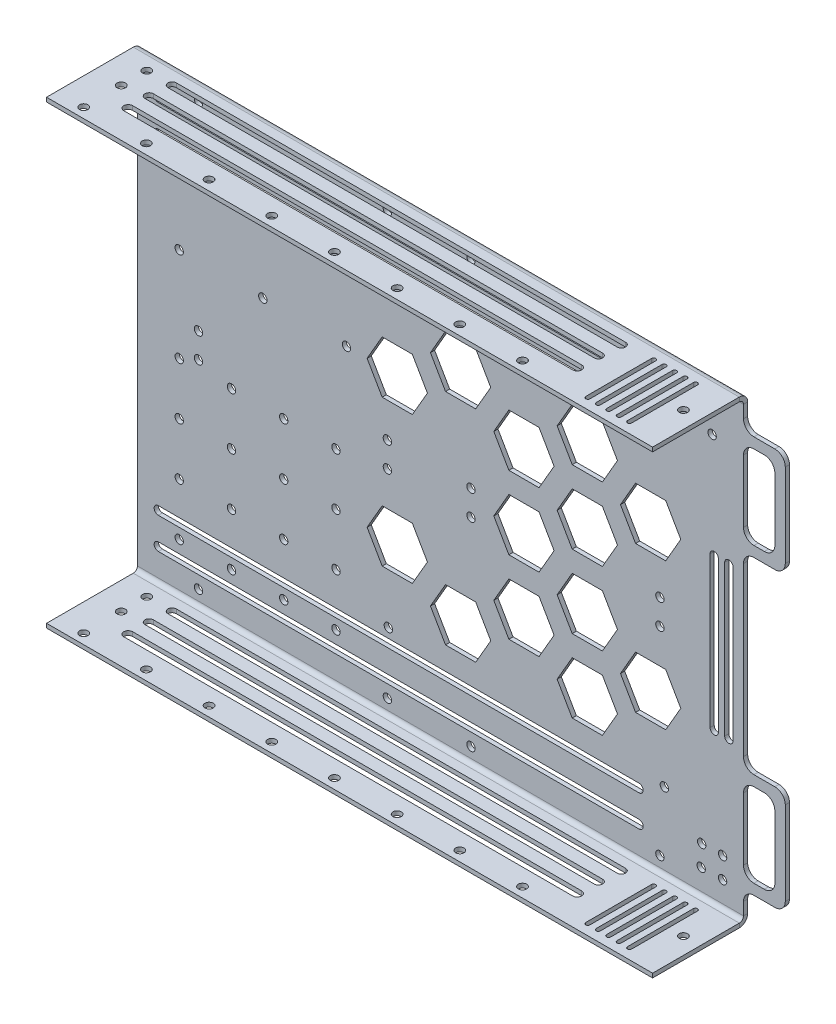
from build123d import *

# Parameters (mm, degrees)
BASE_FLANGE1_DEPTH           = 2
EDGE_FLANGE2_STRIP_W         = 12
EDGE_FLANGE2_STRIP_H         = 2
EDGE_FLANGE2_STRIP_CUT_DEPTH = 290
EDGE_FLANGE2_DEPTH           = 290
SKETCH24_R                   = 2
CUT_EXTRUDE2_DEPTH           = 268.567281258
MINI_ITX_R                   = 2
CUT_EXTRUDE3_DEPTH           = 329.469557189
VARIOS_R                     = 2
CUT_EXTRUDE6_DEPTH           = 329.469557189
CUT_EXTRUDE7_DEPTH           = 329.469557189
SKETCH33_R                   = 2
CUT_EXTRUDE9_DEPTH           = 329.469557189
CUT_EXTRUDE15_DEPTH          = 10


# Sheet-metal steps are written as plain solids
with BuildPart() as part:
    # Sketch1 → Base-Flange1 (new body)
    with BuildSketch(Plane.XY):
        with BuildLine():
            Line((220, 0), (220, 10))
            ThreePointArc((220, 10), (221.464466094, 13.535533906), (225, 15))
            Line((225, 15), (235, 15))
            ThreePointArc((235, 15), (238.535533906, 16.464466094), (240, 20))
            Line((240, 20), (240, 60))
            ThreePointArc((240, 60), (238.535533906, 63.535533906), (235, 65))
            Line((235, 65), (225, 65))
            ThreePointArc((225, 65), (221.464466094, 66.464466094), (220, 70))
            Line((220, 70), (220, 110))
            Line((220, 110), (-70, 110))
            Line((-70, 110), (-70, 0))
            Line((-70, 0), (220, 0))
        make_face()
        with BuildLine():
            Line((230, 20), (225, 20))
            ThreePointArc((225, 20), (221.464466094, 21.464466094), (220, 25))
            Line((220, 25), (220, 55))
            ThreePointArc((220, 55), (221.464466094, 58.535533906), (225, 60))
            Line((225, 60), (230, 60))
            ThreePointArc((230, 60), (233.535533906, 58.535533906), (235, 55))
            Line((235, 55), (235, 25))
            ThreePointArc((235, 25), (233.535533906, 21.464466094), (230, 20))
        make_face(mode=Mode.SUBTRACT)
    extrude(amount=-BASE_FLANGE1_DEPTH)

    # Edge-Flange2 strip (across the edge) → Edge-Flange2 strip cut (cut)
    with BuildSketch(Plane.YZ.offset(-70)):
        with Locations((-2, -1)):
            Rectangle(EDGE_FLANGE2_STRIP_W, EDGE_FLANGE2_STRIP_H)
    extrude(amount=EDGE_FLANGE2_STRIP_CUT_DEPTH, mode=Mode.SUBTRACT)

    # Edge-Flange2 section (across the edge) → Edge-Flange2 (add)
    with BuildSketch(Plane.YZ.offset(-70)):
        with BuildLine():
            Line((0, 2), (0, 43.5))
            Line((0, 43.5), (2, 43.5))
            Line((2, 43.5), (2, 2))
            ThreePointArc((2, 2), (2.585786438, 0.585786438), (4, 0))
            Line((4, 0), (4, -2))
            ThreePointArc((4, -2), (1.171572875, -0.828427125), (0, 2))
        make_face()
    extrude(amount=EDGE_FLANGE2_DEPTH)

    # Sketch24 → Cut-Extrude2 (cut, through all)
    with BuildSketch(Plane.XZ):
        with Locations(Location((-57, 8.5, 0), (0, 0, 270))):
            Circle(SKETCH24_R)
        with Locations(Location((212, 20.75, 0), (0, 0, 270))):
            Circle(SKETCH24_R)
        with Locations(Location((-57, 20.75, 0), (0, 0, 270))):
            Circle(SKETCH24_R)
        with Locations(Location((3, 38.737273217, 0), (0, 0, 270))):
            Circle(SKETCH24_R)
        with Locations(Location((33, 38.737273217, 0), (0, 0, 270))):
            Circle(SKETCH24_R)
        with Locations(Location((63, 38.737273217, 0), (0, 0, 270))):
            Circle(SKETCH24_R)
        with Locations(Location((93, 38.737273217, 0), (0, 0, 270))):
            Circle(SKETCH24_R)
        with Locations(Location((123, 38.737273217, 0), (0, 0, 270))):
            Circle(SKETCH24_R)
        with Locations(Location((153, 38.737273217, 0), (0, 0, 270))):
            Circle(SKETCH24_R)
        with Locations(Location((-27, 38.737273217, 0), (0, 0, 270))):
            Circle(SKETCH24_R)
        with Locations(Location((-57, 38.737273217, 0), (0, 0, 270))):
            Circle(SKETCH24_R)
        with BuildLine():
            Line((205, 38.5), (205, 7))
            ThreePointArc((205, 7), (204, 6), (203, 7))
            Line((203, 7), (203, 38.5))
            ThreePointArc((203, 38.5), (204, 39.5), (205, 38.5))
        make_face()
        with BuildLine():
            Line((198, 7), (198, 38.5))
            ThreePointArc((198, 38.5), (199, 39.5), (200, 38.5))
            Line((200, 38.5), (200, 7))
            ThreePointArc((200, 7), (199, 6), (198, 7))
        make_face()
        with BuildLine():
            Line((193, 7), (193, 38.5))
            ThreePointArc((193, 38.5), (194, 39.5), (195, 38.5))
            Line((195, 38.5), (195, 7))
            ThreePointArc((195, 7), (194, 6), (193, 7))
        make_face()
        with BuildLine():
            Line((188, 7), (188, 38.5))
            ThreePointArc((188, 38.5), (189, 39.5), (190, 38.5))
            Line((190, 38.5), (190, 7))
            ThreePointArc((190, 7), (189, 6), (188, 7))
        make_face()
        with BuildLine():
            Line((183, 7), (183, 38.5))
            ThreePointArc((183, 38.5), (184, 39.5), (185, 38.5))
            Line((185, 38.5), (185, 7))
            ThreePointArc((185, 7), (184, 6), (183, 7))
        make_face()
        with BuildLine():
            Line((168.926386105, 26.384165446), (-45.901348978, 26.384165446))
            ThreePointArc((-45.901348978, 26.384165446), (-48.017183532, 28.5), (-45.901348978, 30.615834554))
            Line((-45.901348978, 30.615834554), (168.926386105, 30.615834554))
            ThreePointArc((168.926386105, 30.615834554), (171.042220659, 28.5), (168.926386105, 26.384165446))
        make_face()
        with BuildLine():
            Line((-45.901348978, 20.5), (169.098651022, 20.5))
            ThreePointArc((169.098651022, 20.5), (171.098651022, 18.5), (169.098651022, 16.5))
            Line((169.098651022, 16.5), (-45.901348978, 16.5))
            ThreePointArc((-45.901348978, 16.5), (-47.901348978, 18.5), (-45.901348978, 20.5))
        make_face()
        with BuildLine():
            Line((170.086040481, 6.5), (-44.913959519, 6.5))
            ThreePointArc((-44.913959519, 6.5), (-46.913959519, 8.5), (-44.913959519, 10.5))
            Line((-44.913959519, 10.5), (170.086040481, 10.5))
            ThreePointArc((170.086040481, 10.5), (172.086040481, 8.5), (170.086040481, 6.5))
        make_face()
    extrude(amount=-CUT_EXTRUDE2_DEPTH, mode=Mode.SUBTRACT)

    # Mirror1: part across plane


with BuildPart() as part_1:
    add(part.part)
    add(part.part.mirror(Plane(origin=(-70, 110, -2), x_dir=(0, 0, 1), z_dir=(0, 1, 0))))

    # Mini-ITX → Cut-Extrude3 (cut, through all)
    with BuildSketch(Plane.XY):
        with Locations((182.14, 38.52)):
            Circle(MINI_ITX_R)
        with Locations((205, 196)):
            Circle(MINI_ITX_R)
        with Locations((50.06, 196)):
            Circle(MINI_ITX_R)
        with Locations((50.06, 38.52)):
            Circle(MINI_ITX_R)
    extrude(amount=-CUT_EXTRUDE3_DEPTH, mode=Mode.SUBTRACT)

    # varios → Cut-Extrude6 (cut, through all)
    with BuildSketch(Plane.XY):
        with Locations((199.745885447, 14)):
            Circle(VARIOS_R)
        with Locations((210, 14)):
            Circle(VARIOS_R)
        with Locations((200, 24)):
            Circle(VARIOS_R)
        with Locations((210, 24)):
            Circle(VARIOS_R)
        with Locations((0, 25)):
            Circle(VARIOS_R)
        with Locations((-25, 25)):
            Circle(VARIOS_R)
        with Locations((0, 50)):
            Circle(VARIOS_R)
        with Locations((-25, 50)):
            Circle(VARIOS_R)
        with Locations((-25, 75)):
            Circle(VARIOS_R)
        with Locations((0, 75)):
            Circle(VARIOS_R)
        with Locations((0, 100)):
            Circle(VARIOS_R)
        with Locations((-25, 100)):
            Circle(VARIOS_R)
        with Locations((-50, 25)):
            Circle(VARIOS_R)
        with Locations((-50, 50)):
            Circle(VARIOS_R)
        with Locations((-50, 75)):
            Circle(VARIOS_R)
        with Locations((-50, 100)):
            Circle(VARIOS_R)
        with Locations((25, 25)):
            Circle(VARIOS_R)
        with Locations((25, 50)):
            Circle(VARIOS_R)
        with Locations((25, 75)):
            Circle(VARIOS_R)
        with Locations((25, 100)):
            Circle(VARIOS_R)
        with Locations((30, 145)):
            Circle(VARIOS_R)
        with Locations((-50, 145)):
            Circle(VARIOS_R)
        with Locations((-50, 195)):
            Circle(VARIOS_R)
        with Locations((30, 195)):
            Circle(VARIOS_R)
        with Locations((-10, 145)):
            Circle(VARIOS_R)
        with Locations((-10, 195)):
            Circle(VARIOS_R)
    extrude(amount=-CUT_EXTRUDE6_DEPTH, mode=Mode.SUBTRACT)

    # Hexagon → Cut-Extrude7 (cut, through all)
    with BuildSketch(Plane.XY):
        Polygon((161.132486541, 145), (168.349364905, 132.5), (182.783121635, 132.5), (190, 145), (182.783121635, 157.5), (168.349364905, 157.5), align=None)
        Polygon((161.132486541, 75), (168.349364905, 62.5), (182.783121635, 62.5), (190, 75), (182.783121635, 87.5), (168.349364905, 87.5), align=None)
        Polygon((130.821597408, 92.5), (138.038475773, 80), (152.472232503, 80), (159.689110868, 92.5), (152.472232503, 105), (138.038475773, 105), align=None)
        Polygon((130.821597408, 127.5), (138.038475773, 115), (152.472232503, 115), (159.689110868, 127.5), (152.472232503, 140), (138.038475773, 140), align=None)
        Polygon((100.510708276, 145), (107.72758664, 132.5), (122.16134337, 132.5), (129.378221735, 145), (122.16134337, 157.5), (107.72758664, 157.5), align=None)
        Polygon((100.510708276, 110), (107.72758664, 97.5), (122.16134337, 97.5), (129.378221735, 110), (122.16134337, 122.5), (107.72758664, 122.5), align=None)
        Polygon((100.510708276, 75), (107.72758664, 62.5), (122.16134337, 62.5), (129.378221735, 75), (122.16134337, 87.5), (107.72758664, 87.5), align=None)
        Polygon((39.888930011, 75), (47.105808376, 62.5), (61.539565105, 62.5), (68.75644347, 75), (61.539565105, 87.5), (47.105808376, 87.5), align=None)
        Polygon((39.888930011, 145), (47.105808376, 132.5), (61.539565105, 132.5), (68.75644347, 145), (61.539565105, 157.5), (47.105808376, 157.5), align=None)
        Polygon((130.821597408, 57.5), (138.038475773, 45), (152.472232503, 45), (159.689110868, 57.5), (152.472232503, 70), (138.038475773, 70), align=None)
        Polygon((70.199819143, 57.5), (77.416697508, 45), (91.850454238, 45), (99.067332603, 57.5), (91.850454238, 70), (77.416697508, 70), align=None)
        Polygon((70.199819143, 162.5), (77.416697508, 150), (91.850454238, 150), (99.067332603, 162.5), (91.850454238, 175), (77.416697508, 175), align=None)
        Polygon((130.821597408, 162.5), (138.038475773, 150), (152.472232503, 150), (159.689110868, 162.5), (152.472232503, 175), (138.038475773, 175), align=None)
    extrude(amount=-CUT_EXTRUDE7_DEPTH, mode=Mode.SUBTRACT)

    # Sketch33 → Cut-Extrude9 (cut, through all)
    with BuildSketch(Plane.XY):
        with Locations((180, 211)):
            Circle(SKETCH33_R)
        with Locations((89.6, 211)):
            Circle(SKETCH33_R)
        with Locations((89.6, 116)):
            Circle(SKETCH33_R)
        with Locations((180, 116)):
            Circle(SKETCH33_R)
        with Locations((180, 104)):
            Circle(SKETCH33_R)
        with Locations((89.6, 104)):
            Circle(SKETCH33_R)
        with Locations((89.6, 9)):
            Circle(SKETCH33_R)
        with Locations((180, 9)):
            Circle(SKETCH33_R)
        with Locations((49.6, 211)):
            Circle(SKETCH33_R)
        with Locations((-40.8, 211)):
            Circle(SKETCH33_R)
        with Locations((-40.8, 116)):
            Circle(SKETCH33_R)
        with Locations((49.6, 116)):
            Circle(SKETCH33_R)
        with Locations((49.6, 104)):
            Circle(SKETCH33_R)
        with Locations((-40.8, 104)):
            Circle(SKETCH33_R)
        with Locations((-40.8, 9)):
            Circle(SKETCH33_R)
        with Locations((49.6, 9)):
            Circle(SKETCH33_R)
    extrude(amount=-CUT_EXTRUDE9_DEPTH, mode=Mode.SUBTRACT)

    # PCIe → Cut-Extrude15 (cut)
    with BuildSketch(Plane.XY):
        with BuildLine():
            Line((211, 74), (211, 146))
            ThreePointArc((211, 146), (213, 148), (215, 146))
            Line((215, 146), (215, 74))
            ThreePointArc((215, 74), (213, 72), (211, 74))
        make_face()
        with BuildLine():
            Line((204, 74), (204, 146))
            ThreePointArc((204, 146), (206, 148), (208, 146))
            Line((208, 146), (208, 74))
            ThreePointArc((208, 74), (206, 72), (204, 74))
        make_face()
        with BuildLine():
            Line((170, 201), (-60, 201))
            ThreePointArc((-60, 201), (-62, 203), (-60, 205))
            Line((-60, 205), (170, 205))
            ThreePointArc((170, 205), (172, 203), (170, 201))
        make_face()
        with BuildLine():
            Line((170, 186), (-60, 186))
            ThreePointArc((-60, 186), (-62, 188), (-60, 190))
            Line((-60, 190), (170, 190))
            ThreePointArc((170, 190), (172, 188), (170, 186))
        make_face()
        with BuildLine():
            Line((170, 15), (-60, 15))
            ThreePointArc((-60, 15), (-62, 17), (-60, 19))
            Line((-60, 19), (170, 19))
            ThreePointArc((170, 19), (172, 17), (170, 15))
        make_face()
        with BuildLine():
            Line((170, 30), (-60, 30))
            ThreePointArc((-60, 30), (-62, 32), (-60, 34))
            Line((-60, 34), (170, 34))
            ThreePointArc((170, 34), (172, 32), (170, 30))
        make_face()
    extrude(amount=-CUT_EXTRUDE15_DEPTH, mode=Mode.SUBTRACT)


solid = part_1.part
